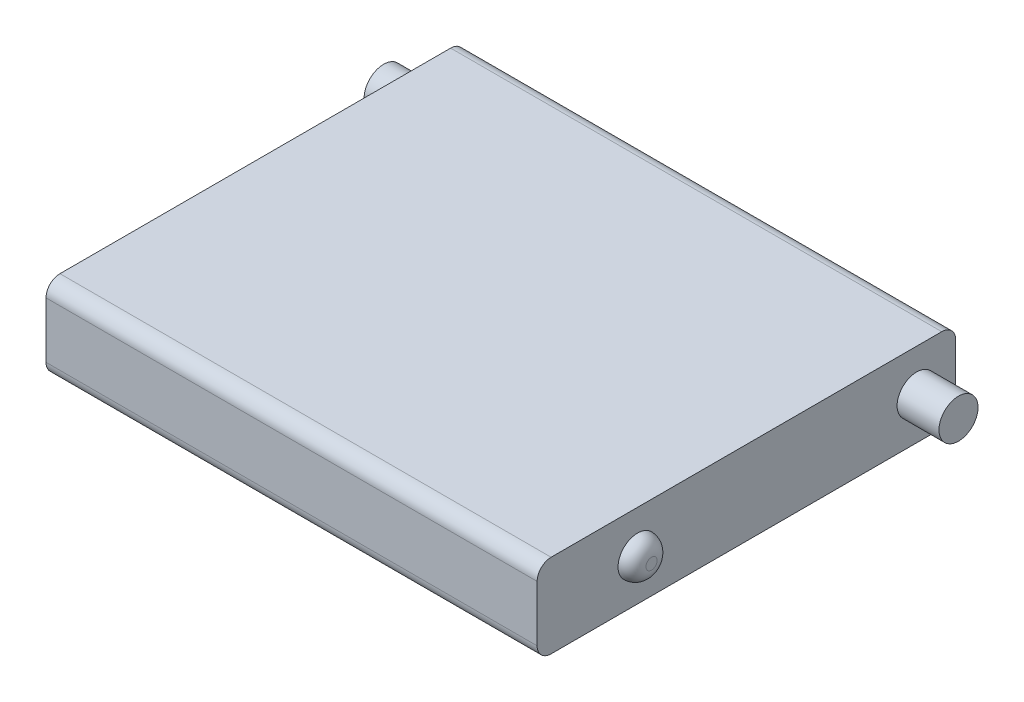
from build123d import *

# Parameters (mm, degrees)
SKETCH1_W            = 17.6
SKETCH1_H            = 15
BOSS_EXTRUDE1_DEPTH  = 1.5
SKETCH2_W            = 14.8
SKETCH2_H            = 10
CUT_EXTRUDE1_DEPTH   = 1.4
SKETCH3_R            = 0.7
BOSS_EXTRUDE2_DEPTH  = 1.5
SKETCH4_R            = 0.7
BOSS_EXTRUDE3_DEPTH  = 0.5
FILLET2_R            = 0.5
FILLET2_OF_MIRROR1_R = 0.5
FILLET1_R            = 0.5


with BuildPart() as part:
    # Sketch1 → Boss-Extrude1 (new, symmetric)
    with BuildSketch(Plane(origin=(0, 0, 0), x_dir=(1, 0, 0), z_dir=(0, 1, 0))):
        Rectangle(SKETCH1_W, SKETCH1_H)
    extrude(amount=BOSS_EXTRUDE1_DEPTH, both=True)

    # Sketch2 → Cut-Extrude1 (cut)
    with BuildSketch(Plane.XZ.offset(1.5)):
        Rectangle(SKETCH2_W, SKETCH2_H)
    extrude(amount=-CUT_EXTRUDE1_DEPTH, mode=Mode.SUBTRACT)

    # Sketch3 → Boss-Extrude2 (add)
    with BuildSketch(Plane.ZY.offset(8.8)):
        with Locations(Location((-6.1, 0, 0), (0, 0, 180))):
            Circle(SKETCH3_R)
    boss_extrude2 = extrude(amount=BOSS_EXTRUDE2_DEPTH)

    # Sketch4 → Boss-Extrude3 (add)
    with BuildSketch(Plane.ZY.offset(8.8)):
        with Locations(Location((3.9, 0, 0), (0, 0, 180))):
            Circle(SKETCH4_R)
    boss_extrude3 = extrude(amount=BOSS_EXTRUDE3_DEPTH)

    # Fillet2
    fillet2_edges = [part.edges().sort_by_distance(p)[0] for p in [
        (-9.3, 0, 4.6),
    ]]
    fillet(fillet2_edges, radius=FILLET2_R - 0.0001)  # a hair under: the kernel refuses the full size

    # Mirror1: Boss-Extrude2, Boss-Extrude3 across plane
    add(boss_extrude2.mirror(Plane(origin=(0, 0, 0), x_dir=(0, 0, 1), z_dir=(1, 0, 0))))
    add(boss_extrude3.mirror(Plane(origin=(0, 0, 0), x_dir=(0, 0, 1), z_dir=(1, 0, 0))))

    # Fillet2 of Mirror1
    fillet2_of_mirror1_edges = [part.edges().sort_by_distance(p)[0] for p in [
        (9.3, 0, 4.6),
    ]]
    fillet(fillet2_of_mirror1_edges, radius=FILLET2_OF_MIRROR1_R - 0.0001)  # a hair under: the kernel refuses the full size

    # Fillet1
    fillet1_edges = [part.edges().sort_by_distance(p)[0] for p in [
        (0, 1.5, 7.5),
        (0, -1.5, 7.5),
        (0, -1.5, -7.5),
        (0, 1.5, -7.5),
    ]]
    fillet(fillet1_edges, radius=FILLET1_R)


solid = part.part
